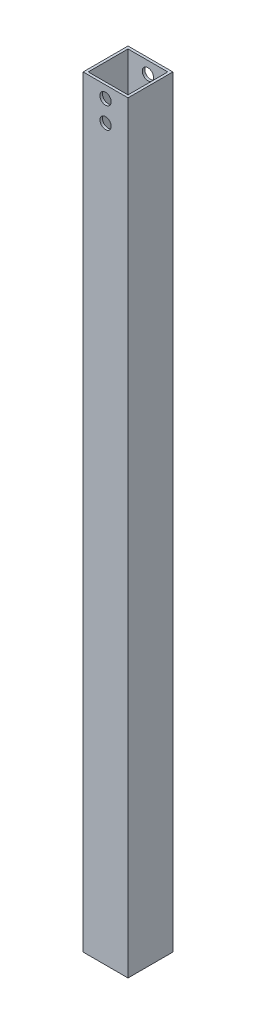
from build123d import *

# Parameters (mm, degrees)
SKETCH1_W               = 26.924
SKETCH1_H               = 26.924
SKETCH1_W_2             = 23.876
SKETCH1_H_2             = 23.876
EXTRUDE_THIN1_DEPTH     = 457.2
F_1_4_CLEARANCE_HOLE1_D = 6.7564


with BuildPart() as part:
    # Sketch1 → Extrude-Thin1 (new body)
    with BuildSketch(Plane(origin=(0, 0, 0), x_dir=(1, 0, 0), z_dir=(0, 1, 0))):
        Rectangle(SKETCH1_W, SKETCH1_H)
        Rectangle(SKETCH1_W_2, SKETCH1_H_2, mode=Mode.SUBTRACT)
    extrude(amount=EXTRUDE_THIN1_DEPTH)

    # 1/4 Clearance Hole1 (through all)
    with Locations(Plane(origin=(0, 0, -13.462), x_dir=(-1, 0, 0), z_dir=(0, 0, -1))):
        with Locations((0, 450.0245), (0, 437.3245)):
            Hole(F_1_4_CLEARANCE_HOLE1_D / 2)


solid = part.part
